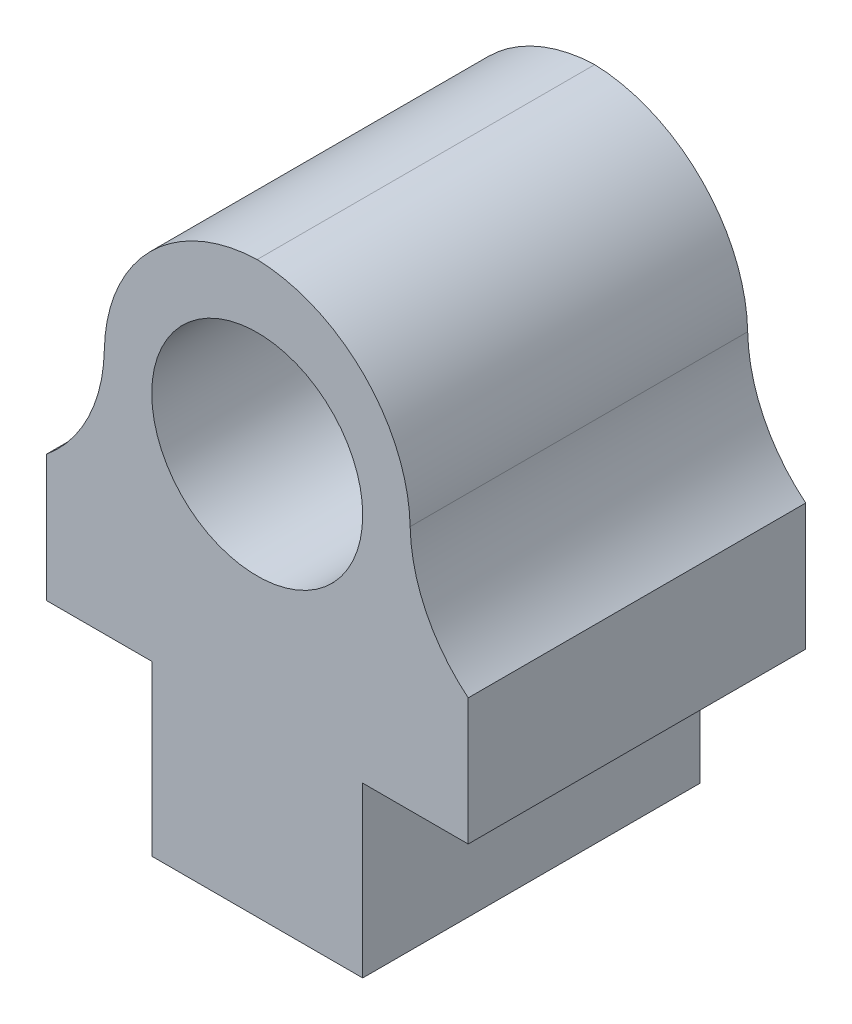
from build123d import *

# Parameters (mm, degrees)
SKETCH6_W           = 20
SKETCH6_H           = 16
BOSS_EXTRUDE5_DEPTH = 6
SKETCH7_W           = 10
SKETCH7_H           = 16
BOSS_EXTRUDE6_DEPTH = 8
SKETCH8_W           = 14.5
SKETCH8_H           = 16
BOSS_EXTRUDE7_DEPTH = 13
SKETCH9_R           = 5
CUT_EXTRUDE1_DEPTH  = 32.890437438
FILLET1_R           = 7.5
FILLET2_R           = 7.5


with BuildPart() as part:
    # Sketch6 → Boss-Extrude5 (new body)
    with BuildSketch(Plane(origin=(0, 0, 0), x_dir=(1, 0, 0), z_dir=(0, 1, 0))):
        with Locations((10, 8)):
            Rectangle(SKETCH6_W, SKETCH6_H)
    extrude(amount=BOSS_EXTRUDE5_DEPTH)

    # Sketch7 → Boss-Extrude6 (add)
    with BuildSketch(Plane.XZ):
        with Locations((10, -8)):
            Rectangle(SKETCH7_W, SKETCH7_H)
    extrude(amount=BOSS_EXTRUDE6_DEPTH)

    # Sketch8 → Boss-Extrude7 (add)
    with BuildSketch(Plane(origin=(0, 6, 0), x_dir=(1, 0, 0), z_dir=(0, 1, 0))):
        with Locations((10, 8)):
            Rectangle(SKETCH8_W, SKETCH8_H)
    extrude(amount=BOSS_EXTRUDE7_DEPTH)

    # Sketch9 → Cut-Extrude1 (cut, through all)
    with BuildSketch(Plane.XY):
        with Locations((10, 11)):
            Circle(SKETCH9_R)
    extrude(amount=-CUT_EXTRUDE1_DEPTH, mode=Mode.SUBTRACT)

    # Fillet1
    # the kernel refuses this fillet: 7.5 mm, written as the material it takes off along each edge
    with BuildSketch(Plane(origin=(17.25, 19, -34.75), x_dir=(-1, 0, 0), z_dir=(0, 0, 1))) as fillet1_piece_1:
        with BuildLine():
            CenterArc((FILLET1_R, FILLET1_R), FILLET1_R, 180, 90)
            Line((0, FILLET1_R), (0, 0))
            Line((0, 0), (FILLET1_R, 0))
        make_face()
    extrude(amount=53.5, mode=Mode.SUBTRACT)
    with BuildSketch(Plane(origin=(2.75, 19, 18.75), x_dir=(0, -1, 0), z_dir=(0, 0, -1))) as fillet1_piece_2:
        with BuildLine():
            CenterArc((FILLET1_R, -FILLET1_R), FILLET1_R, 90, 90)
            Line((0, -FILLET1_R), (0, 0))
            Line((0, 0), (FILLET1_R, 0))
        make_face()
    extrude(amount=53.5, mode=Mode.SUBTRACT)

    # Fillet2
    # the kernel refuses this fillet: 7.5 mm, written as the material it adds along each edge
    with BuildSketch(Plane(origin=(17.25, 6, -16), x_dir=(1, 0, 0), z_dir=(0, 0, 1))) as fillet2_piece_1:
        with BuildLine():
            CenterArc((7.496865043, 5.806657581), FILLET2_R, 181.171427285, 49.563032728)
            Line((-0.001567478, 5.65332879), (-0.75141073, 5.637995911))
            ThreePointArc((-0.75141073, 5.637995911), (-0.75, 5.5), (-0.75, 0))
            Line((-0.75, 0), (0, -0.75))
            ThreePointArc((0, -0.75), (1.375, -0.75), (2.275313496, -0.580665758))
            Line((2.275313496, -0.580665758), (2.75, 0))
        make_face()
    extrude(amount=16)
    with BuildSketch(Plane(origin=(2.75, 6, 0), x_dir=(0.00027726642617420565, 0.9999999615616638, 0), z_dir=(0, 0, -1))) as fillet2_piece_2:
        with BuildLine():
            CenterArc((5.804578729, -7.498474746), FILLET2_R, 91.155541089, 49.563032728)
            Line((-0.000762483, -2.749999894), (-0.581296604, -2.275152409))
            ThreePointArc((-0.581296604, -2.275152409), (-0.750381213, -1.374791997), (-0.749999971, 0.00020795))
            Line((-0.749999971, 0.00020795), (0.00020795, 0.749999971))
            ThreePointArc((0.00020795, 0.749999971), (5.500207738, 0.748475006), (5.638204036, 0.749847475))
            Line((5.638204036, 0.749847475), (5.653329008, 0))
        make_face()
    extrude(amount=16)


solid = part.part
